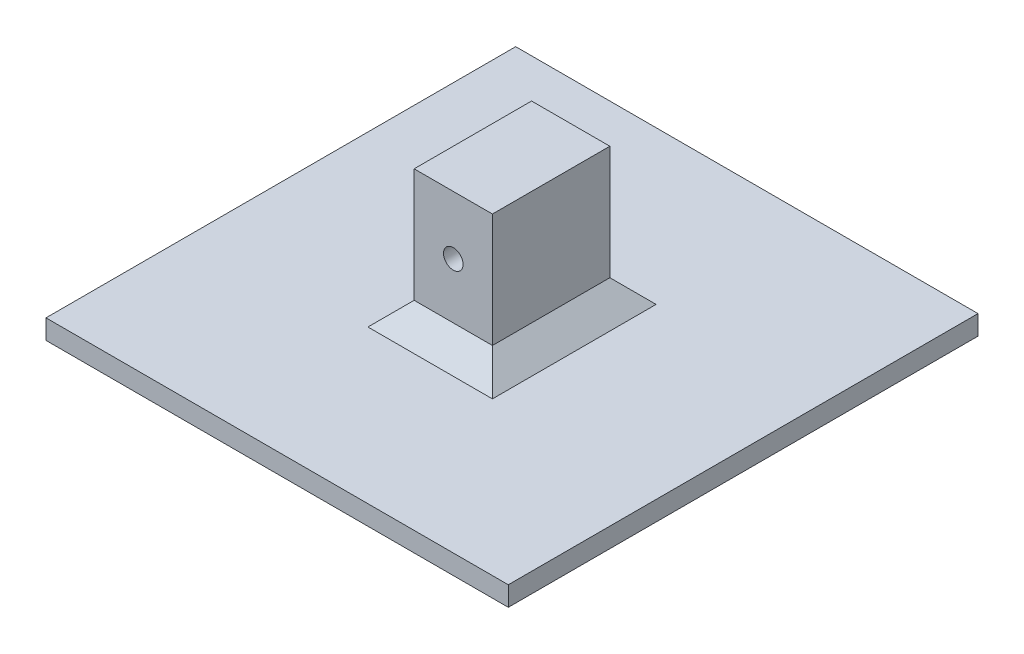
from build123d import *

# Parameters (mm, degrees)
BOSS_EXTRUDE1_DEPTH         = 12.7
BOSS_EXTRUDE1_DEPTH_BACK    = 12.7
F_1_4_0_25_DIAMETER_HOLE1_D = 6.35
BOSS_EXTRUDE2_DEPTH         = 75
BOSS_EXTRUDE2_DEPTH_BACK    = 75
SKETCH6_W                   = 152.4
SKETCH6_H                   = 6.35
CHAMFER1_SIZE               = 7.5


with BuildPart() as part:
    # Sketch-Profile → Boss-Extrude1 (new, two sides: drawn at the far end of the back side and taken through both)
    with BuildSketch(Plane(origin=(0, 0, 0), x_dir=(0, 0, -1), z_dir=(1, 0, 0)).offset(-BOSS_EXTRUDE1_DEPTH_BACK)):
        Polygon((-76.2, 6.35), (-76.2, 0), (76.2, 0), (76.2, 6.35), (19.05, 6.35), (19.05, 50.8), (-19.05, 50.8), (-19.05, 6.35), align=None)
    extrude(amount=BOSS_EXTRUDE1_DEPTH + BOSS_EXTRUDE1_DEPTH_BACK)

    # 1/4 (0.25) Diameter Hole1 (through all)
    with Locations(Plane.XY.offset(19.05)):
        with Locations((0, 31.8431)):
            Hole(F_1_4_0_25_DIAMETER_HOLE1_D / 2)

    # Sketch6 → Boss-Extrude2 (add, two sides: drawn at the far end of the back side and taken through both)
    with BuildSketch(Plane(origin=(0, 0, 0), x_dir=(0, 0, -1), z_dir=(1, 0, 0)).offset(-BOSS_EXTRUDE2_DEPTH_BACK)):
        with Locations((0, 3.175)):
            Rectangle(SKETCH6_W, SKETCH6_H)
    extrude(amount=BOSS_EXTRUDE2_DEPTH + BOSS_EXTRUDE2_DEPTH_BACK)

    # Chamfer1
    chamfer1_edges = [part.edges().sort_by_distance(p)[0] for p in [
        (0, 6.35, 19.05),
        (-12.7, 6.35, 0),
        (0, 6.35, -19.05),
        (12.7, 6.35, 0),
    ]]
    chamfer(chamfer1_edges, length=CHAMFER1_SIZE)


solid = part.part
